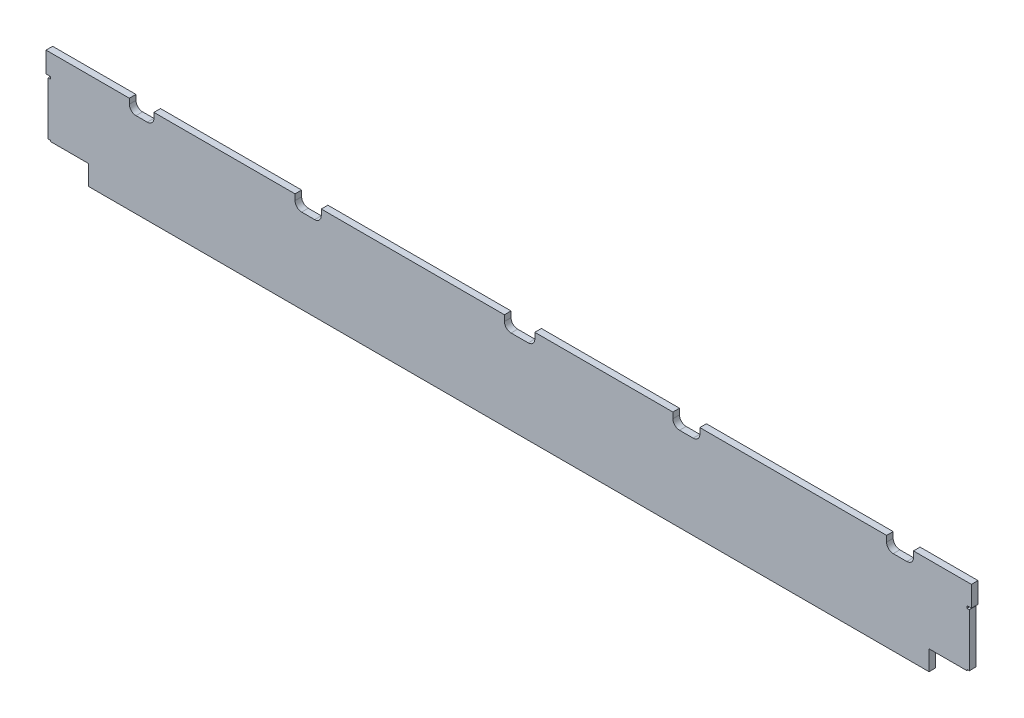
from build123d import *

# Parameters (mm, degrees)
BOSS_EXTRUDE1_DEPTH = 3.175


with BuildPart() as part:
    # Sketch2 → Boss-Extrude1 (new body)
    with BuildSketch(Plane.XY):
        with BuildLine():
            Line((-134.48222397, -157.216000107), (-174.499179878, -157.216000106))
            Line((-174.499179878, -157.216000106), (-174.499179878, -167.122000106))
            Line((-174.499179878, -167.122000106), (-172.356179878, -167.122000107))
            Line((-172.356179878, -167.122000107), (-172.356179878, -168.265000107))
            Line((-172.356179878, -168.265000107), (-173.499179878, -168.265000106))
            Line((-173.499179878, -168.265000106), (-173.499179878, -193.665000106))
            Line((-173.499179878, -193.665000106), (-172.356179878, -193.665000107))
            Line((-172.356179878, -193.665000107), (-172.356179878, -194.181000107))
            Line((-172.356179878, -194.181000107), (-154.179179878, -194.181000107))
            Line((-154.179179878, -194.181000107), (-154.179179878, -203.714000107))
            Line((-154.179179878, -203.714000107), (249.446820082, -203.714000112))
            Line((249.446820082, -203.714000112), (249.446820082, -194.181000112))
            Line((249.446820082, -194.181000112), (267.623820082, -194.181000112))
            Line((267.623820082, -194.181000112), (267.623820082, -193.665000112))
            Line((267.623820082, -193.665000112), (268.766820082, -193.665000112))
            Line((268.766820082, -193.665000112), (268.766820082, -168.265000112))
            Line((268.766820082, -168.265000112), (267.623820082, -168.265000112))
            Line((267.623820082, -168.265000112), (267.623820082, -167.122000112))
            Line((267.623820082, -167.122000112), (269.766820082, -167.122000112))
            Line((269.766820082, -167.122000112), (269.766820082, -157.216000112))
            Line((269.766820082, -157.216000112), (241.942931342, -157.216000112))
            Line((241.942931342, -157.216000112), (241.942931342, -160.028852642))
            ThreePointArc((241.942931342, -160.028852642), (241.012995373, -162.273916672), (238.767931342, -163.203852641))
            Line((238.767931342, -163.203852641), (232.228835621, -163.203852641))
            ThreePointArc((232.228835621, -163.203852641), (229.983771591, -162.273916672), (229.053835621, -160.028852641))
            Line((229.053835621, -160.028852641), (229.053835621, -157.216000112))
            Line((229.053835621, -157.216000112), (139.391671268, -157.216000111))
            Line((139.391671268, -157.216000111), (139.391671268, -160.028852642))
            ThreePointArc((139.391671268, -160.028852642), (138.461735298, -162.273916672), (136.216671268, -163.203852642))
            Line((136.216671268, -163.203852642), (129.634287036, -163.203852642))
            ThreePointArc((129.634287036, -163.203852642), (127.389223006, -162.273916672), (126.459287037, -160.028852642))
            Line((126.459287037, -160.028852642), (126.459287037, -157.21600011))
            Line((126.459287037, -157.21600011), (60.173906138, -157.21600011))
            Line((60.173906138, -157.21600011), (60.173906138, -160.028852642))
            ThreePointArc((60.173906138, -160.028852642), (59.243970168, -162.273916672), (56.998906138, -163.203852642))
            Line((56.998906138, -163.203852642), (48.759688994, -163.203852642))
            ThreePointArc((48.759688994, -163.203852642), (46.514624964, -162.273916672), (45.584688995, -160.028852642))
            Line((45.584688995, -160.028852642), (45.584688995, -157.216000109))
            Line((45.584688995, -157.216000109), (-42.350318447, -157.216000108))
            Line((-42.350318447, -157.216000108), (-42.350318447, -160.028852642))
            ThreePointArc((-42.350318447, -160.028852642), (-43.280254417, -162.273916672), (-45.525318447, -163.203852641))
            Line((-45.525318447, -163.203852641), (-51.766012694, -163.203852641))
            ThreePointArc((-51.766012694, -163.203852641), (-54.011076724, -162.273916672), (-54.941012694, -160.028852641))
            Line((-54.941012694, -160.028852641), (-54.941012694, -157.216000108))
            Line((-54.941012694, -157.216000108), (-122.690938882, -157.216000107))
            Line((-122.690938882, -157.216000107), (-122.690938882, -159.695723948))
            ThreePointArc((-122.690938882, -159.695723948), (-123.620874852, -161.940787978), (-125.865938882, -162.870723948))
            Line((-125.865938882, -162.870723948), (-131.307223971, -162.870723948))
            ThreePointArc((-131.307223971, -162.870723948), (-133.552288001, -161.940787978), (-134.48222397, -159.695723948))
            Line((-134.48222397, -159.695723948), (-134.48222397, -157.216000107))
        make_face()
    extrude(amount=BOSS_EXTRUDE1_DEPTH)


solid = part.part
